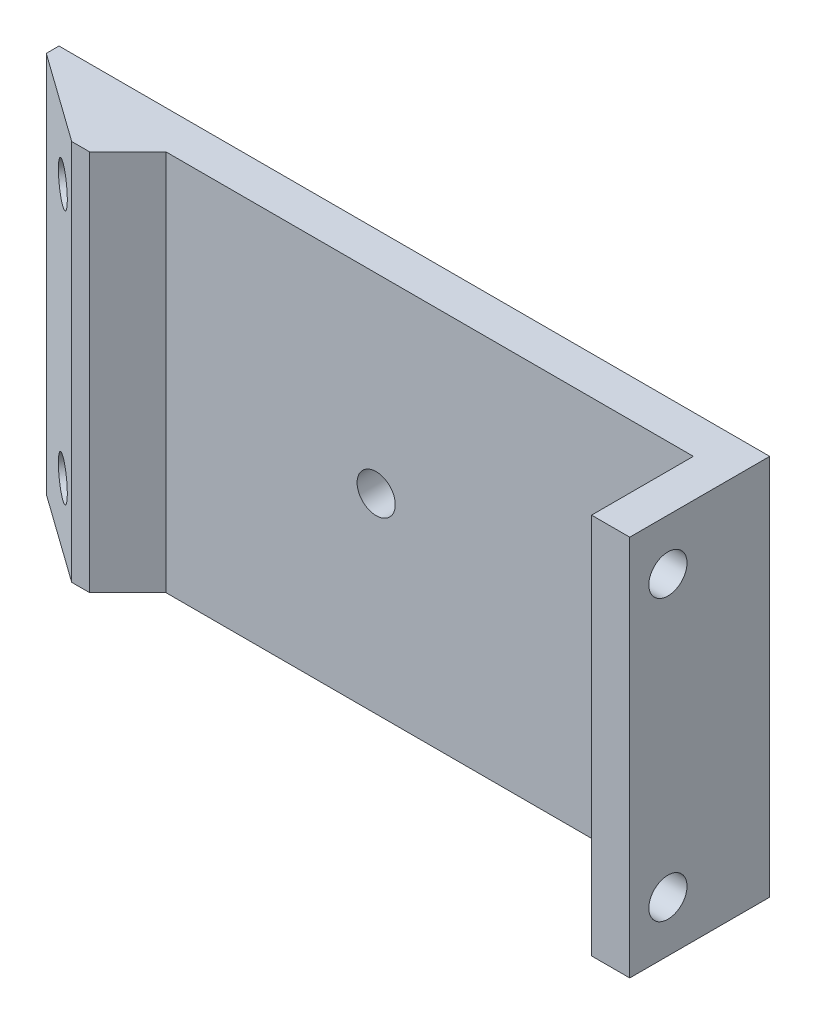
from build123d import *

# Parameters (mm, degrees)
SKETCH1_W           = 55.85
SKETCH1_H           = 30
BOSS_EXTRUDE1_DEPTH = 3
SKETCH2_W           = 8.4
SKETCH2_H           = 30
BOSS_EXTRUDE2_DEPTH = 3
CHAMFER1_SIZE       = 5
CHAMFER1_SIZE2      = 7
SKETCH3_R           = 1.5
CUT_EXTRUDE1_DEPTH  = 3
CHAMFER2_SIZE       = 3
CUT_EXTRUDE2_START  = -3
CUT_EXTRUDE2_DEPTH  = 8
SKETCH5_W           = 3
SKETCH5_H           = 30
BOSS_EXTRUDE3_DEPTH = 8
SKETCH6_R           = 1.5
CUT_EXTRUDE3_DEPTH  = 8
SKETCH7_R           = 1.5
CUT_EXTRUDE4_DEPTH  = 34.553027062


with BuildPart() as part:
    # Sketch1 → Boss-Extrude1 (new body)
    with BuildSketch(Plane.XY):
        Rectangle(SKETCH1_W, SKETCH1_H)
    extrude(amount=BOSS_EXTRUDE1_DEPTH)

    # Sketch2 → Boss-Extrude2 (add)
    with BuildSketch(Plane.XY.offset(3)):
        with Locations((-23.725, 0)):
            Rectangle(SKETCH2_W, SKETCH2_H)
    extrude(amount=BOSS_EXTRUDE2_DEPTH)

    # Chamfer1
    chamfer1_edges = [part.edges().sort_by_distance(p)[0] for p in [
        (-27.925, 0, 6),
    ]]
    chamfer1_side = [part.faces().sort_by_distance(p)[0] for p in [
        (-27.925, 0, 3),
    ]]
    chamfer(chamfer1_edges, length=CHAMFER1_SIZE, length2=CHAMFER1_SIZE2, reference=chamfer1_side[0])

    # Sketch3 → Cut-Extrude1 (cut)
    with BuildSketch(Plane(origin=(-9.907094595, 0, 13.869932432), x_dir=(0.8137334712067354, 0, 0.5812381937190957), z_dir=(-0.5812381937190957, 0, 0.8137334712067354))):
        with Locations((-16.539943723, 10)):
            Circle(SKETCH3_R)
        with Locations((-16.539943723, -10)):
            Circle(SKETCH3_R)
    extrude(amount=-CUT_EXTRUDE1_DEPTH, mode=Mode.SUBTRACT)

    # Chamfer2
    chamfer2_edges = [part.edges().sort_by_distance(p)[0] for p in [
        (-19.525, 0, 3),
    ]]
    chamfer(chamfer2_edges, length=CHAMFER2_SIZE - 0.0001)  # a hair under: the kernel refuses the full size

    # Sketch4 → Cut-Extrude2 (cut)
    with BuildSketch(Plane(origin=(-9.907094595, 0, 13.869932432), x_dir=(0.8137334712067354, 0, 0.5812381937190959), z_dir=(-0.5812381937190958, 0, 0.8137334712067353)).offset(CUT_EXTRUDE2_START)):
        Polygon((-14.730494791, 7.39055027), (-13.3753695, 10.262303877), (-15.184818432, 12.871753607), (-18.349392655, 12.60944973), (-19.704517945, 9.737696123), (-17.895069013, 7.128246393), align=None)
        Polygon((-14.730494791, -7.39055027), (-17.895069013, -7.128246393), (-19.704517945, -9.737696123), (-18.349392655, -12.60944973), (-15.184818432, -12.871753607), (-13.3753695, -10.262303877), align=None)
    extrude(amount=-CUT_EXTRUDE2_DEPTH, mode=Mode.SUBTRACT)

    # Sketch5 → Boss-Extrude3 (add)
    with BuildSketch(Plane.XY.offset(3)):
        with Locations((26.425, 0)):
            Rectangle(SKETCH5_W, SKETCH5_H)
    extrude(amount=BOSS_EXTRUDE3_DEPTH)

    # Sketch6 → Cut-Extrude3 (cut)
    with BuildSketch(Plane(origin=(27.925, 0, 0), x_dir=(0, 0, -1), z_dir=(1, 0, 0))):
        with Locations((-8, 11)):
            Circle(SKETCH6_R)
        with Locations((-8, -11)):
            Circle(SKETCH6_R)
    extrude(amount=-CUT_EXTRUDE3_DEPTH, mode=Mode.SUBTRACT)

    # Sketch7 → Cut-Extrude4 (cut, through all)
    with BuildSketch(Plane(origin=(0, 0, 0), x_dir=(-1, 0, 0), z_dir=(0, 0, -1))):
        Circle(SKETCH7_R)
    extrude(amount=-CUT_EXTRUDE4_DEPTH, mode=Mode.SUBTRACT)


solid = part.part
